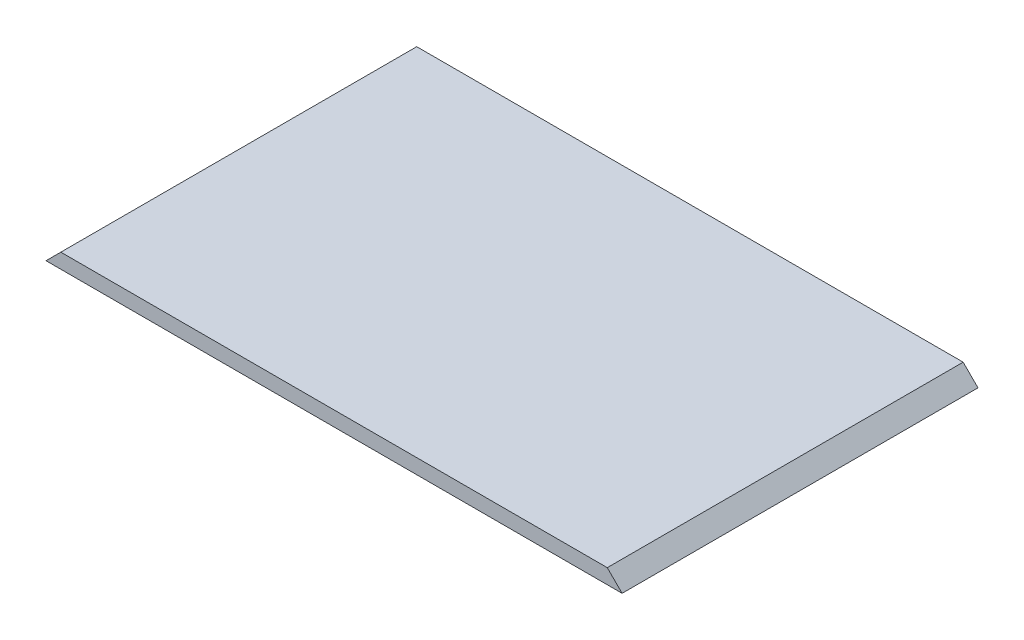
from build123d import *

# Parameters (mm, degrees)
SKETCH2_W           = 254
SKETCH2_H           = 152.4
BOSS_EXTRUDE1_DEPTH = 3.175
CHAMFER1_SIZE       = 10
CHAMFER2_SIZE       = 10


with BuildPart() as part:
    # Sketch2 → Boss-Extrude1 (new, symmetric)
    with BuildSketch(Plane(origin=(0, 0, 0), x_dir=(1, 0, 0), z_dir=(0, 1, 0))):
        Rectangle(SKETCH2_W, SKETCH2_H)
    extrude(amount=BOSS_EXTRUDE1_DEPTH, both=True)

    # Chamfer1
    # the kernel refuses this chamfer: 10 mm, written as the material it takes off along each edge
    with BuildSketch(Plane(origin=(-127, 3.175, -101.91682988), x_dir=(-0.027495876610586317, -0.9996219169112968, 0), z_dir=(0, 0, 1))) as chamfer1_piece_1:
        Polygon((CHAMFER1_SIZE * 0.999621916911, CHAMFER1_SIZE * 0.0274958766106), (-CHAMFER1_SIZE * 0.0274958766106, CHAMFER1_SIZE * 0.999621916911), (0, 0), align=None)
    extrude(amount=203.833659759, mode=Mode.SUBTRACT)

    # Chamfer2
    # the kernel refuses this chamfer: 10 mm, written as the material it takes off along each edge
    with BuildSketch(Plane(origin=(127, 3.175, 101.91682988), x_dir=(-0.9996219169112968, 0.02749587661058636, 0), z_dir=(0, 0, -1))) as chamfer2_piece_1:
        Polygon((CHAMFER2_SIZE * 0.999621916911, -CHAMFER2_SIZE * 0.0274958766106), (-CHAMFER2_SIZE * 0.0274958766106, -CHAMFER2_SIZE * 0.999621916911), (0, 0), align=None)
    extrude(amount=203.833659759, mode=Mode.SUBTRACT)


solid = part.part
